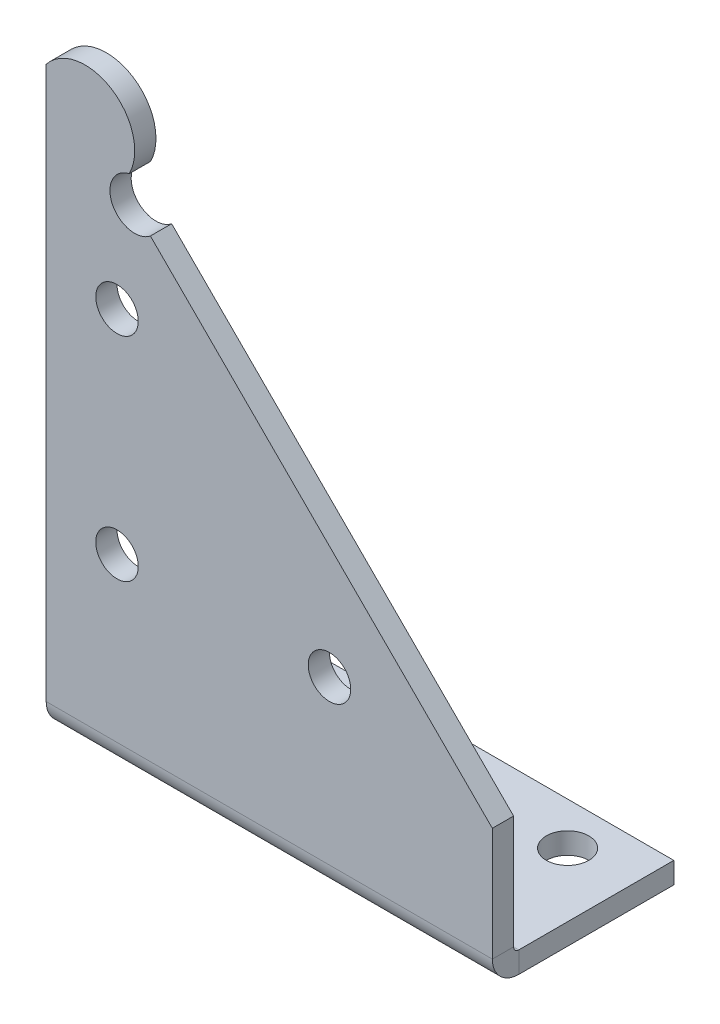
from build123d import *

# Parameters (mm, degrees)
SCHIZZO2_R                           = 3
BASE_FLANGIA1_DEPTH                  = 3
PIEGATURA_START                      = -41.4
PIEGATURA_DELLO_SCHIZZO1_OUTLINE_W   = 63
PIEGATURA_DELLO_SCHIZZO1_OUTLINE_H   = 3
PIEGATURA_DELLO_SCHIZZO1_DEPTH       = 21.6634
PIEGATURA_START_2                    = -19.383939692
PIEGATURA_DELLO_SCHIZZO1_2_OUTLINE_W = 63
PIEGATURA_DELLO_SCHIZZO1_2_OUTLINE_H = 22.623356935
PIEGATURA_DELLO_SCHIZZO1_2_OUTLINE_R = 3
PIEGATURA_DELLO_SCHIZZO1_2_DEPTH     = 2.647339692
PIEGATURA_START_3                    = -19.7366
PIEGATURA_DELLO_SCHIZZO1_3_OUTLINE_W = 63
PIEGATURA_DELLO_SCHIZZO1_3_OUTLINE_H = 22.623356935
PIEGATURA_DELLO_SCHIZZO1_3_OUTLINE_R = 3
PIEGATURA_DELLO_SCHIZZO1_3_DEPTH     = 3.7366
PIEGATURA_START_4                    = -64
PIEGATURA_DELLO_SCHIZZO1_4_DEPTH     = 64


with BuildPart() as part:
    # Base-Flangia1: sheet metal written as solids
    # Schizzo2 → Base-Flangia1 (new body)
    with BuildSketch(Plane.XY):
        with BuildLine():
            Line((0, 0), (0, -41.4))
            Line((0, -41.4), (-63, -41.4))
            Line((-63, -41.4), (-63, 61.925683224))
            ThreePointArc((-63, 61.925683224), (-53.724596428, 63.490157792), (-51.266546346, 54.410582808))
            ThreePointArc((-51.266546346, 54.410582808), (-53.647048092, 49.463861618), (-48.285339065, 48.285339065))
            Line((-48.285339065, 48.285339065), (0, 0))
        make_face()
        with Locations((-53, 37)):
            Circle(SCHIZZO2_R, mode=Mode.SUBTRACT)
        with Locations((-53, 7)):
            Circle(SCHIZZO2_R, mode=Mode.SUBTRACT)
        with Locations((-23, 7)):
            Circle(SCHIZZO2_R, mode=Mode.SUBTRACT)
        with Locations((-53, -35.4)):
            Circle(SCHIZZO2_R, mode=Mode.SUBTRACT)
        with Locations((-31, -32.4)):
            Circle(SCHIZZO2_R, mode=Mode.SUBTRACT)
        with Locations((-9, -35.4)):
            Circle(SCHIZZO2_R, mode=Mode.SUBTRACT)
    extrude(amount=-BASE_FLANGIA1_DEPTH)

    # Piegatura dello schizzo1: read off the stored shape, not the designer's step
    # Piegatura dello schizzo1 outline → Piegatura dello schizzo1 (cut)
    with BuildSketch(Plane(origin=(0, 0, 0), x_dir=(1, 0, 0), z_dir=(0, 1, 0)).offset(PIEGATURA_START)):
        with Locations((-31.5, 1.5)):
            Rectangle(PIEGATURA_DELLO_SCHIZZO1_OUTLINE_W, PIEGATURA_DELLO_SCHIZZO1_OUTLINE_H)
    extrude(amount=PIEGATURA_DELLO_SCHIZZO1_DEPTH, mode=Mode.SUBTRACT)

    # Piegatura dello schizzo1 2 outline → Piegatura dello schizzo1 2 (add)
    with BuildSketch(Plane(origin=(0, 0, 0), x_dir=(1, 0, 0), z_dir=(0, 1, 0)).offset(PIEGATURA_START_2)):
        with Locations((-31.5, 14.311678468)):
            Rectangle(PIEGATURA_DELLO_SCHIZZO1_2_OUTLINE_W, PIEGATURA_DELLO_SCHIZZO1_2_OUTLINE_H)
        with Locations((-53, 19.623356935)):
            Circle(PIEGATURA_DELLO_SCHIZZO1_2_OUTLINE_R, mode=Mode.SUBTRACT)
        with Locations((-31, 16.623356935)):
            Circle(PIEGATURA_DELLO_SCHIZZO1_2_OUTLINE_R, mode=Mode.SUBTRACT)
        with Locations((-9, 19.623356935)):
            Circle(PIEGATURA_DELLO_SCHIZZO1_2_OUTLINE_R, mode=Mode.SUBTRACT)
    extrude(amount=PIEGATURA_DELLO_SCHIZZO1_2_DEPTH)

    # Piegatura dello schizzo1 3 outline → Piegatura dello schizzo1 3 (add)
    with BuildSketch(Plane(origin=(0, 0, 0), x_dir=(1, 0, 0), z_dir=(0, 1, 0)).offset(PIEGATURA_START_3)):
        with Locations((-31.5, 14.311678468)):
            Rectangle(PIEGATURA_DELLO_SCHIZZO1_3_OUTLINE_W, PIEGATURA_DELLO_SCHIZZO1_3_OUTLINE_H)
        with Locations((-53, 19.623356935)):
            Circle(PIEGATURA_DELLO_SCHIZZO1_3_OUTLINE_R, mode=Mode.SUBTRACT)
        with Locations((-31, 16.623356935)):
            Circle(PIEGATURA_DELLO_SCHIZZO1_3_OUTLINE_R, mode=Mode.SUBTRACT)
        with Locations((-9, 19.623356935)):
            Circle(PIEGATURA_DELLO_SCHIZZO1_3_OUTLINE_R, mode=Mode.SUBTRACT)
    extrude(amount=PIEGATURA_DELLO_SCHIZZO1_3_DEPTH)

    # Piegatura dello schizzo1 4 outline → Piegatura dello schizzo1 4 (cut)
    with BuildSketch(Plane.YZ.offset(PIEGATURA_START_4)):
        with BuildLine():
            ThreePointArc((-16, -3), (-16.520854855, -3.215745145), (-16.7366, -3.7366))
            Line((-16.7366, -3.7366), (-16.7366, -25.623356935))
            Line((-16.7366, -25.623356935), (-16, -25.623356935))
            Line((-16, -25.623356935), (-16, -3))
        make_face()
        with BuildLine():
            Line((-19.7366, 0), (-19.7366, -3.7366))
            ThreePointArc((-19.7366, -3.7366), (-18.642175199, -1.094424801), (-16, 0))
            Line((-16, 0), (-19.7366, 0))
        make_face()
    extrude(amount=PIEGATURA_DELLO_SCHIZZO1_4_DEPTH, mode=Mode.SUBTRACT)


solid = part.part
